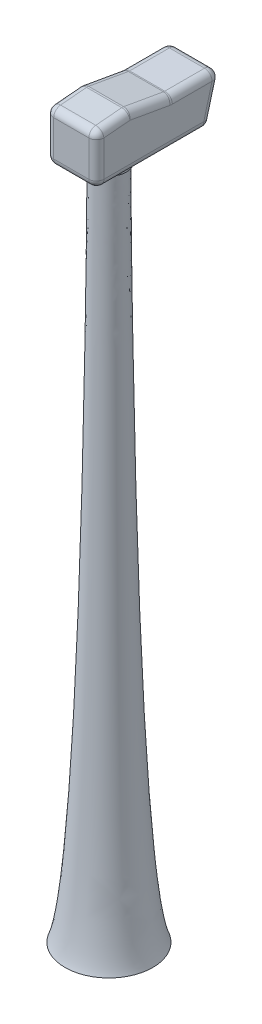
from build123d import *

# Parameters (mm, degrees)
AUFSATZ_LINEAR_AUSTRAGEN1_DEPTH      = 4800
AUFSATZ_LINEAR_AUSTRAGEN1_DEPTH_BACK = 4800
VERRUNDUNG1_R                        = 1440


with BuildPart() as part:
    # Skizze2 → Aufsatz-Linear austragen1 (new, two sides: drawn at the far end of the back side and taken through both)
    with BuildSketch(Plane(origin=(0, 0, 0), x_dir=(0, 0, -1), z_dir=(1, 0, 0)).offset(-AUFSATZ_LINEAR_AUSTRAGEN1_DEPTH_BACK)):
        Polygon((2800, -4800), (2800, 4800), (9280, 5366.926539648), (17200, 3970.416852437), (26800, 3970.416852437), (24449.973887105, -4800), align=None)
    extrude(amount=AUFSATZ_LINEAR_AUSTRAGEN1_DEPTH + AUFSATZ_LINEAR_AUSTRAGEN1_DEPTH_BACK)

    # Verrundung1
    verrundung1_edges = [part.edges().sort_by_distance(p)[0] for p in [
        (0, -4800, -24449.973887105),
        (-4800, -414.791573782, -25624.986943553),
        (-4800, -4800, -13624.986943553),
        (-4800, 0, -2800),
        (0, -4800, -2800),
        (4800, 0, -2800),
        (4800, -414.791573782, -25624.986943553),
        (4800, -4800, -13624.986943553),
        (-4800, 3970.416852437, -22000),
        (0, 3970.416852437, -26800),
        (4800, 3970.416852437, -22000),
        (-4800, 4668.671696042, -13240),
        (0, 3970.416852437, -17200),
        (4800, 4668.671696042, -13240),
        (-4800, 5083.463269824, -6040),
        (0, 5366.926539648, -9280),
        (4800, 5083.463269824, -6040),
        (0, 4800, -2800),
    ]]
    fillet(verrundung1_edges, radius=VERRUNDUNG1_R)

    # Skizze3 → Rotation1 (revolve)
    with BuildSketch(Plane(origin=(0, 0, 0), x_dir=(0, 0, -1), z_dir=(1, 0, 0))):
        with BuildLine():
            Line((10000, -3360), (6640, -3360))
            Line((6640, -3360), (6640, -5760))
            Line((6640, -5760), (6880, -5760))
            Line((6880, -5760), (6880, -4800))
            Line((6880, -4800), (7024, -4800))
            Line((7024, -4800), (7024, -5760))
            add(Edge.make_bspline(
                [(7024, -5760), (7024, -6115.39669448), (6652.669617387, -122885.695492531), (1600, -135000)],
                knots=[0, 0, 0, 0, 1, 1, 1, 1], degree=3))
            Line((1600, -135000), (10000, -135000))
            Line((10000, -135000), (10000, -3360))
        make_face()
    revolve(axis=Axis((0, 0, -10000), (0, -1, 0)))


solid = part.part
